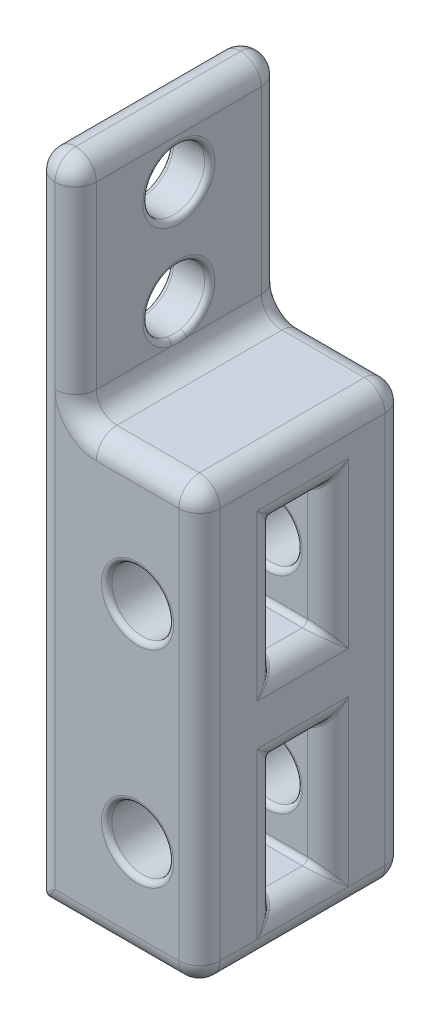
from build123d import *

# Parameters (mm, degrees)
BOSS_EXTRU_1_DEPTH           = 10
ENL_V_MAT_EXTRU_1_DEPTH      = 1.2
ENL_V_MAT_EXTRU_1_DEPTH_BACK = 1.24
ESQUISSE3_R                  = 1.5
ENL_V_MAT_EXTRU_2_REACH      = 25.787
ESQUISSE5_R                  = 1.5
ENL_V_MAT_EXTRU_3_REACH      = 26.203
ESQUISSE6_R                  = 1.5
CONG_2_R                     = 1
CONG_3_R                     = 0.25


with BuildPart() as part:
    # Esquisse1 → Boss.-Extru.1 (new body)
    with BuildSketch(Plane.XY):
        Polygon((-4, -10.5), (4, -10.5), (4, 10.5), (-2, 10.5), (-2, 21.208552273), (-4, 21.208552273), align=None)
    extrude(amount=BOSS_EXTRU_1_DEPTH)

    # Esquisse3 → Enlèv. mat.-Extru.1 (cut, two sides: drawn at the far end of the back side and taken through both)
    # profile 1 of 2: a face of its own
    with BuildSketch(Plane.XY.offset(5).offset(-ENL_V_MAT_EXTRU_1_DEPTH_BACK)):
        Polygon((2.732050808, 7.5), (5.251382704, 7.5), (5.251382704, 1.5), (2.732050808, 1.5), (-0.732050808, 1.5), (-2.464101615, 4.5), (-0.732050808, 7.5), align=None)
        with Locations((1, 4.5)):
            Circle(ESQUISSE3_R, mode=Mode.SUBTRACT)
    # profile 2 of 2: a face of its own
    with BuildSketch(Plane.XY.offset(5).offset(-ENL_V_MAT_EXTRU_1_DEPTH_BACK)):
        Polygon((2.732050808, -2.5), (-0.732050808, -2.5), (-2.464101615, -5.5), (-0.732050808, -8.5), (2.732050808, -8.5), (5.251382704, -8.5), (5.251382704, -2.5), align=None)
        with Locations((1, -5.5)):
            Circle(ESQUISSE3_R, mode=Mode.SUBTRACT)
    extrude(amount=ENL_V_MAT_EXTRU_1_DEPTH + ENL_V_MAT_EXTRU_1_DEPTH_BACK, mode=Mode.SUBTRACT)

    # Esquisse5 → Enlèv. mat.-Extru.2 (cut, up to next)
    with BuildSketch(Plane.XY.offset(10), mode=Mode.PRIVATE) as enl_v_mat_extru_2_sk1:
        with Locations((1, 4.5)):
            Circle(ESQUISSE5_R)
    enl_v_mat_extru_2_tool1 = extrude(enl_v_mat_extru_2_sk1.sketch, amount=-ENL_V_MAT_EXTRU_2_REACH, mode=Mode.PRIVATE) & part.part
    # Esquisse5 → Enlèv. mat.-Extru.2 (cut, up to next)
    with BuildSketch(Plane.XY.offset(10), mode=Mode.PRIVATE) as enl_v_mat_extru_2_sk2:
        with Locations((1, -5.5)):
            Circle(ESQUISSE5_R)
    enl_v_mat_extru_2_tool2 = extrude(enl_v_mat_extru_2_sk2.sketch, amount=-ENL_V_MAT_EXTRU_2_REACH, mode=Mode.PRIVATE) & part.part
    add(enl_v_mat_extru_2_tool1.solids().sort_by_distance((1, 4.5, 10))[0], mode=Mode.SUBTRACT)
    add(enl_v_mat_extru_2_tool2.solids().sort_by_distance((1, -5.5, 10))[0], mode=Mode.SUBTRACT)

    # Esquisse6 → Enlèv. mat.-Extru.3 (cut, up to next)
    with BuildSketch(Plane(origin=(-2, 0, 0), x_dir=(0, 0, -1), z_dir=(1, 0, 0)), mode=Mode.PRIVATE) as enl_v_mat_extru_3_sk1:
        with Locations((-5, 18.208552273)):
            Circle(ESQUISSE6_R)
    enl_v_mat_extru_3_tool1 = extrude(enl_v_mat_extru_3_sk1.sketch, amount=-ENL_V_MAT_EXTRU_3_REACH, mode=Mode.PRIVATE) & part.part
    # Esquisse6 → Enlèv. mat.-Extru.3 (cut, up to next)
    with BuildSketch(Plane(origin=(-2, 0, 0), x_dir=(0, 0, -1), z_dir=(1, 0, 0)), mode=Mode.PRIVATE) as enl_v_mat_extru_3_sk2:
        with Locations((-5, 13.208552273)):
            Circle(ESQUISSE6_R)
    enl_v_mat_extru_3_tool2 = extrude(enl_v_mat_extru_3_sk2.sketch, amount=-ENL_V_MAT_EXTRU_3_REACH, mode=Mode.PRIVATE) & part.part
    add(enl_v_mat_extru_3_tool1.solids().sort_by_distance((-2, 18.208552, 5))[0], mode=Mode.SUBTRACT)
    add(enl_v_mat_extru_3_tool2.solids().sort_by_distance((-2, 13.208552, 5))[0], mode=Mode.SUBTRACT)

    # Congé2
    cong_2_edges = [part.edges().sort_by_distance(p)[0] for p in [
        (0, -10.5, 10),
        (-2, 10.5, 5),
        (4, 0, 10),
        (-4, 21.208552273, 5),
        (-2, 21.208552273, 5),
        (-2, 15.854276137, 10),
        (-3, 21.208552273, 10),
        (1, 10.5, 10),
        (-2, 15.854276137, 0),
        (-3, 21.208552273, 0),
        (4, -5.5, 3.76),
        (4, -2.5, 4.98),
        (4, -8.5, 4.98),
        (4, -5.5, 6.2),
        (4, 4.5, 3.76),
        (4, 1.5, 4.98),
        (4, 7.5, 4.98),
        (4, 4.5, 6.2),
        (1, 10.5, 0),
        (-4, 5.354276137, 10),
        (4, 0, 0),
        (0, -10.5, 0),
        (-4, 5.354276137, 0),
        (4, 10.5, 5),
        (4, -10.5, 5),
    ]]
    fillet(cong_2_edges, radius=CONG_2_R - 0.0001)  # a hair under: the kernel refuses the full size

    # Congé3
    cong_3_edges = [part.edges().sort_by_distance(p)[0] for p in [
        (-4, 18.208552273, 6.5),
        (-2, 18.208552273, 6.5),
        (-4, -10.5, 5),
        (1.134024596, 7.5, 3.76),
        (1.134024596, 1.5, 3.76),
        (1.134024596, 7.5, 6.2),
        (1.134024596, 1.5, 6.2),
        (3.763319687, -2.146084303, 6.553915697),
        (3.763319687, -2.146084303, 3.406084303),
        (3.763319687, -8.853915697, 6.553915697),
        (3.763319687, -8.853915697, 3.406084303),
        (-3.646084303, -10.146084303, 9.763319687),
        (-3.646084303, -10.146084303, 0.236680313),
        (3.763319687, 1.146084303, 6.553915697),
        (3.763319687, 7.853915697, 6.553915697),
        (3.763319687, 1.146084303, 3.406084303),
        (3.763319687, 7.853915697, 3.406084303),
        (-1.598076211, 6, 6.2),
        (-1.598076211, 3, 6.2),
        (-0.732050808, 1.5, 4.98),
        (-0.732050808, 7.5, 4.98),
        (-1.598076211, 6, 3.76),
        (-2.464101615, 4.5, 4.98),
        (-1.598076211, 3, 3.76),
        (-1.598076211, -4, 6.2),
        (-1.598076211, -7, 6.2),
        (1.134024596, -8.5, 6.2),
        (1.134024596, -8.5, 3.76),
        (-0.732050808, -8.5, 4.98),
        (1.134024596, -2.5, 6.2),
        (1.134024596, -2.5, 3.76),
        (-0.732050808, -2.5, 4.98),
        (-1.598076211, -4, 3.76),
        (-2.464101615, -5.5, 4.98),
        (-1.598076211, -7, 3.76),
        (-0.5, 4.5, 6.2),
        (-0.5, 4.5, 3.76),
        (-0.5, 4.5, 10),
        (-0.5, 4.5, 0),
        (-0.5, -5.5, 6.2),
        (-0.5, -5.5, 3.76),
        (-0.5, -5.5, 10),
        (-0.5, -5.5, 0),
        (-4, 13.208552273, 6.5),
        (-2, 13.208552273, 6.5),
    ]]
    fillet(cong_3_edges, radius=CONG_3_R)


solid = part.part
